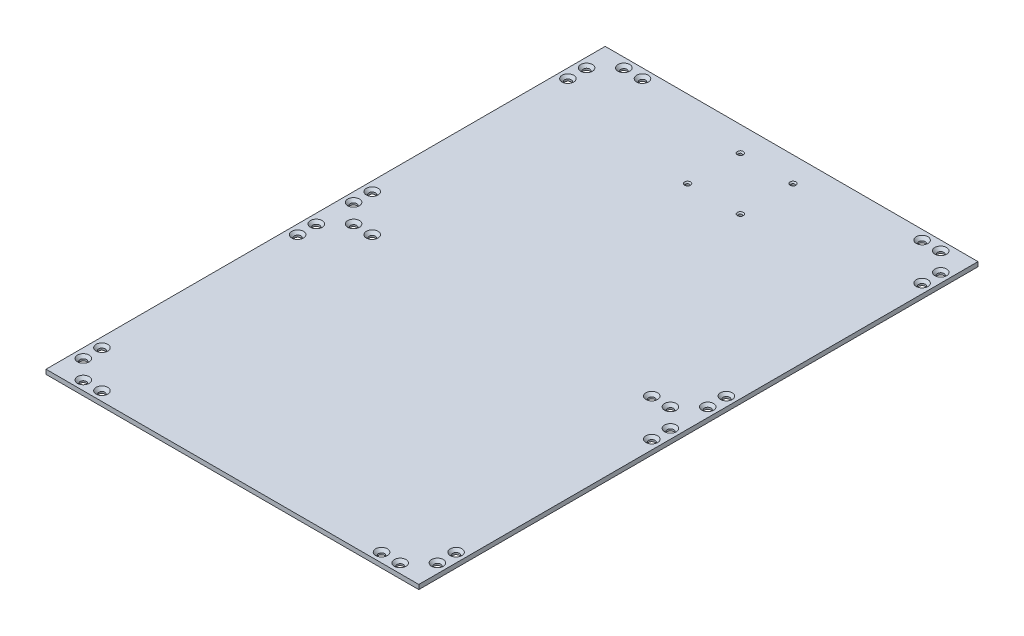
from build123d import *

# Parameters (mm, degrees)
SKETCH1_W                                       = 400
SKETCH1_H                                       = 600
BOSS_EXTRUDE1_DEPTH                             = 4.826
CSK_FOR_M6_FLAT_HEAD_MACHINE_SCREW2_AT_2_COUNT  = 2
CSK_FOR_M6_FLAT_HEAD_MACHINE_SCREW2_AT_2_PITCH  = 20
CSK_FOR_M6_FLAT_HEAD_MACHINE_SCREW2_AT_3_COUNT  = 2
CSK_FOR_M6_FLAT_HEAD_MACHINE_SCREW2_AT_3_PITCH  = 290
CSK_FOR_M6_FLAT_HEAD_MACHINE_SCREW2_AT_4_COUNT  = 2
CSK_FOR_M6_FLAT_HEAD_MACHINE_SCREW2_AT_4_PITCH  = 290.688837075
CSK_FOR_M6_FLAT_HEAD_MACHINE_SCREW2_AT_5_COUNT  = 2
CSK_FOR_M6_FLAT_HEAD_MACHINE_SCREW2_AT_5_PITCH  = 580
CSK_FOR_M6_FLAT_HEAD_MACHINE_SCREW2_AT_6_COUNT  = 2
CSK_FOR_M6_FLAT_HEAD_MACHINE_SCREW2_AT_6_PITCH  = 580.344725142
CSK_FOR_M6_FLAT_HEAD_MACHINE_SCREW2_AT_7_COUNT  = 2
CSK_FOR_M6_FLAT_HEAD_MACHINE_SCREW2_AT_7_PITCH  = 672.309452559
CSK_FOR_M6_FLAT_HEAD_MACHINE_SCREW2_AT_8_COUNT  = 2
CSK_FOR_M6_FLAT_HEAD_MACHINE_SCREW2_AT_8_PITCH  = 662.419806467
CSK_FOR_M6_FLAT_HEAD_MACHINE_SCREW2_AT_9_COUNT  = 2
CSK_FOR_M6_FLAT_HEAD_MACHINE_SCREW2_AT_9_PITCH  = 446.87805943
CSK_FOR_M6_FLAT_HEAD_MACHINE_SCREW2_AT_1_COUNT  = 2
CSK_FOR_M6_FLAT_HEAD_MACHINE_SCREW2_AT_1_PITCH  = 431.856457634
CSK_FOR_M6_FLAT_HEAD_MACHINE_SCREW2_2_COUNT     = 2
CSK_FOR_M6_FLAT_HEAD_MACHINE_SCREW2_2_PITCH     = 340
CSK_FOR_M6_FLAT_HEAD_MACHINE_SCREW2_3_COUNT     = 2
CSK_FOR_M6_FLAT_HEAD_MACHINE_SCREW2_3_PITCH     = 320
CSK_FOR_M3_FLAT_HEAD_MACHINE_SCREW1_D           = 3.6
CSK_FOR_M3_FLAT_HEAD_MACHINE_SCREW1_CSINK_D     = 6.3
CSK_FOR_M3_FLAT_HEAD_MACHINE_SCREW1_CSINK_ANGLE = 90
CSK_FOR_M6_FLAT_HEAD_MACHINE_SCREW3_AT_2_COUNT  = 2
CSK_FOR_M6_FLAT_HEAD_MACHINE_SCREW3_AT_2_PITCH  = 20
CSK_FOR_M6_FLAT_HEAD_MACHINE_SCREW3_AT_3_COUNT  = 2
CSK_FOR_M6_FLAT_HEAD_MACHINE_SCREW3_AT_3_PITCH  = 40
CSK_FOR_M6_FLAT_HEAD_MACHINE_SCREW3_AT_4_COUNT  = 2
CSK_FOR_M6_FLAT_HEAD_MACHINE_SCREW3_AT_4_PITCH  = 60
CSK_FOR_M6_FLAT_HEAD_MACHINE_SCREW3_AT_5_COUNT  = 2
CSK_FOR_M6_FLAT_HEAD_MACHINE_SCREW3_AT_5_PITCH  = 380
CSK_FOR_M6_FLAT_HEAD_MACHINE_SCREW3_AT_6_COUNT  = 2
CSK_FOR_M6_FLAT_HEAD_MACHINE_SCREW3_AT_6_PITCH  = 380.525951809
CSK_FOR_M6_FLAT_HEAD_MACHINE_SCREW3_AT_7_COUNT  = 2
CSK_FOR_M6_FLAT_HEAD_MACHINE_SCREW3_AT_7_PITCH  = 382.099463491
CSK_FOR_M6_FLAT_HEAD_MACHINE_SCREW3_AT_8_COUNT  = 2
CSK_FOR_M6_FLAT_HEAD_MACHINE_SCREW3_AT_8_PITCH  = 384.707681233
CSK_FOR_M6_FLAT_HEAD_MACHINE_SCREW3_AT_9_COUNT  = 2
CSK_FOR_M6_FLAT_HEAD_MACHINE_SCREW3_AT_9_PITCH  = 444.18464629
CSK_FOR_M6_FLAT_HEAD_MACHINE_SCREW3_AT_1_COUNT  = 2
CSK_FOR_M6_FLAT_HEAD_MACHINE_SCREW3_AT_1_PITCH  = 454.862616622
CSK_FOR_M6_FLAT_HEAD_MACHINE_SCREW3_2_COUNT     = 2
CSK_FOR_M6_FLAT_HEAD_MACHINE_SCREW3_2_PITCH     = 250
CSK_FOR_M6_FLAT_HEAD_MACHINE_SCREW3_3_COUNT     = 2
CSK_FOR_M6_FLAT_HEAD_MACHINE_SCREW3_3_PITCH     = 230
CSK_FOR_M6_FLAT_HEAD_MACHINE_SCREW3_4_COUNT     = 2
CSK_FOR_M6_FLAT_HEAD_MACHINE_SCREW3_4_PITCH     = 290
CSK_FOR_M6_FLAT_HEAD_MACHINE_SCREW3_5_COUNT     = 2
CSK_FOR_M6_FLAT_HEAD_MACHINE_SCREW3_5_PITCH     = 270
CSK_FOR_M6_FLAT_HEAD_MACHINE_SCREW3_6_COUNT     = 2
CSK_FOR_M6_FLAT_HEAD_MACHINE_SCREW3_6_PITCH     = 478.016736109
CSK_FOR_M6_FLAT_HEAD_MACHINE_SCREW3_7_COUNT     = 2
CSK_FOR_M6_FLAT_HEAD_MACHINE_SCREW3_7_PITCH     = 466.154480832


with BuildPart() as part:
    # Sketch1 → Boss-Extrude1 (new body)
    with BuildSketch(Plane(origin=(0, 0, 0), x_dir=(1, 0, 0), z_dir=(0, 1, 0))):
        with Locations((200, -300)):
            Rectangle(SKETCH1_W, SKETCH1_H)
    extrude(amount=BOSS_EXTRUDE1_DEPTH)

    # Sketch8 → CSK for M6 Flat Head Machine Screw2 (revolve, cut)
    with BuildSketch(Plane(origin=(370, 4.826, 10), x_dir=(0, 0, 1), z_dir=(1, 0, 0))):
        Polygon((0, 0), (0, 4.826), (3.3, 4.826), (3.3, 3), (6.3, 0), align=None)
    csk_for_m6_flat_head_machine_screw2 = revolve(axis=Axis((370, 11.176, 10), (0, -1, 0)), mode=Mode.SUBTRACT)

    # CSK for M6 Flat Head Machine Screw2 at 2: CSK for M6 Flat Head Machine Screw2 ×2
    with Locations(*[(-i * CSK_FOR_M6_FLAT_HEAD_MACHINE_SCREW2_AT_2_PITCH, 0, 0) for i in range(1, CSK_FOR_M6_FLAT_HEAD_MACHINE_SCREW2_AT_2_COUNT)]):
        add(csk_for_m6_flat_head_machine_screw2, mode=Mode.SUBTRACT)

    # CSK for M6 Flat Head Machine Screw2 at 3: CSK for M6 Flat Head Machine Screw2 ×2
    with Locations(*[(0, 0, i * CSK_FOR_M6_FLAT_HEAD_MACHINE_SCREW2_AT_3_PITCH) for i in range(1, CSK_FOR_M6_FLAT_HEAD_MACHINE_SCREW2_AT_3_COUNT)]):
        add(csk_for_m6_flat_head_machine_screw2, mode=Mode.SUBTRACT)

    # CSK for M6 Flat Head Machine Screw2 at 4: CSK for M6 Flat Head Machine Screw2 ×2
    with Locations(*[Vector(-0.06880209161537774, 0, 0.9976303284229832) * (i * CSK_FOR_M6_FLAT_HEAD_MACHINE_SCREW2_AT_4_PITCH) for i in range(1, CSK_FOR_M6_FLAT_HEAD_MACHINE_SCREW2_AT_4_COUNT)]):
        add(csk_for_m6_flat_head_machine_screw2, mode=Mode.SUBTRACT)

    # CSK for M6 Flat Head Machine Screw2 at 5: CSK for M6 Flat Head Machine Screw2 ×2
    with Locations(*[(0, 0, i * CSK_FOR_M6_FLAT_HEAD_MACHINE_SCREW2_AT_5_PITCH) for i in range(1, CSK_FOR_M6_FLAT_HEAD_MACHINE_SCREW2_AT_5_COUNT)]):
        add(csk_for_m6_flat_head_machine_screw2, mode=Mode.SUBTRACT)

    # CSK for M6 Flat Head Machine Screw2 at 6: CSK for M6 Flat Head Machine Screw2 ×2
    with Locations(*[Vector(-0.03446227583977849, 0, 0.9994059993535875) * (i * CSK_FOR_M6_FLAT_HEAD_MACHINE_SCREW2_AT_6_PITCH) for i in range(1, CSK_FOR_M6_FLAT_HEAD_MACHINE_SCREW2_AT_6_COUNT)]):
        add(csk_for_m6_flat_head_machine_screw2, mode=Mode.SUBTRACT)

    # CSK for M6 Flat Head Machine Screw2 at 7: CSK for M6 Flat Head Machine Screw2 ×2
    with Locations(*[Vector(-0.5057194997124201, 0, 0.8626979700976579) * (i * CSK_FOR_M6_FLAT_HEAD_MACHINE_SCREW2_AT_7_PITCH) for i in range(1, CSK_FOR_M6_FLAT_HEAD_MACHINE_SCREW2_AT_7_COUNT)]):
        add(csk_for_m6_flat_head_machine_screw2, mode=Mode.SUBTRACT)

    # CSK for M6 Flat Head Machine Screw2 at 8: CSK for M6 Flat Head Machine Screw2 ×2
    with Locations(*[Vector(-0.48307734291133475, 0, 0.8755776840267943) * (i * CSK_FOR_M6_FLAT_HEAD_MACHINE_SCREW2_AT_8_PITCH) for i in range(1, CSK_FOR_M6_FLAT_HEAD_MACHINE_SCREW2_AT_8_COUNT)]):
        add(csk_for_m6_flat_head_machine_screw2, mode=Mode.SUBTRACT)

    # CSK for M6 Flat Head Machine Screw2 at 9: CSK for M6 Flat Head Machine Screw2 ×2
    with Locations(*[Vector(-0.7608339519590858, 0, 0.6489466060827498) * (i * CSK_FOR_M6_FLAT_HEAD_MACHINE_SCREW2_AT_9_PITCH) for i in range(1, CSK_FOR_M6_FLAT_HEAD_MACHINE_SCREW2_AT_9_COUNT)]):
        add(csk_for_m6_flat_head_machine_screw2, mode=Mode.SUBTRACT)

    # CSK for M6 Flat Head Machine Screw2 at 1: CSK for M6 Flat Head Machine Screw2 ×2
    with Locations(*[Vector(-0.7409869514359826, 0, 0.6715194247388595) * (i * CSK_FOR_M6_FLAT_HEAD_MACHINE_SCREW2_AT_1_PITCH) for i in range(1, CSK_FOR_M6_FLAT_HEAD_MACHINE_SCREW2_AT_1_COUNT)]):
        add(csk_for_m6_flat_head_machine_screw2, mode=Mode.SUBTRACT)

    # CSK for M6 Flat Head Machine Screw2  2: CSK for M6 Flat Head Machine Screw2 ×2
    with Locations(*[(-i * CSK_FOR_M6_FLAT_HEAD_MACHINE_SCREW2_2_PITCH, 0, 0) for i in range(1, CSK_FOR_M6_FLAT_HEAD_MACHINE_SCREW2_2_COUNT)]):
        add(csk_for_m6_flat_head_machine_screw2, mode=Mode.SUBTRACT)

    # CSK for M6 Flat Head Machine Screw2  3: CSK for M6 Flat Head Machine Screw2 ×2
    with Locations(*[(-i * CSK_FOR_M6_FLAT_HEAD_MACHINE_SCREW2_3_PITCH, 0, 0) for i in range(1, CSK_FOR_M6_FLAT_HEAD_MACHINE_SCREW2_3_COUNT)]):
        add(csk_for_m6_flat_head_machine_screw2, mode=Mode.SUBTRACT)

    # CSK for M3 Flat Head Machine Screw1 (through all)
    with Locations(Plane(origin=(0, 4.826, 0), x_dir=(1, 0, 0), z_dir=(0, 1, 0))):
        with Locations((171.715728753, -26.715728753), (228.284271247, -26.715728753), (228.284271247, -83.284271247), (171.715728753, -83.284271247)):
            CounterSinkHole(CSK_FOR_M3_FLAT_HEAD_MACHINE_SCREW1_D / 2, CSK_FOR_M3_FLAT_HEAD_MACHINE_SCREW1_CSINK_D / 2, counter_sink_angle=CSK_FOR_M3_FLAT_HEAD_MACHINE_SCREW1_CSINK_ANGLE)

    # Sketch12 → CSK for M6 Flat Head Machine Screw3 (revolve, cut)
    with BuildSketch(Plane(origin=(10, 4.826, 320), x_dir=(0, 0, 1), z_dir=(1, 0, 0))):
        Polygon((0, 0), (0, 4.826), (3.5, 4.826), (3.5, 2.8), (6.3, 0), align=None)
    csk_for_m6_flat_head_machine_screw3 = revolve(axis=Axis((10, 11.176, 320), (0, -1, 0)), mode=Mode.SUBTRACT)

    # CSK for M6 Flat Head Machine Screw3 at 2: CSK for M6 Flat Head Machine Screw3 ×2
    with Locations(*[(0, 0, i * CSK_FOR_M6_FLAT_HEAD_MACHINE_SCREW3_AT_2_PITCH) for i in range(1, CSK_FOR_M6_FLAT_HEAD_MACHINE_SCREW3_AT_2_COUNT)]):
        add(csk_for_m6_flat_head_machine_screw3, mode=Mode.SUBTRACT)

    # CSK for M6 Flat Head Machine Screw3 at 3: CSK for M6 Flat Head Machine Screw3 ×2
    with Locations(*[(0, 0, -i * CSK_FOR_M6_FLAT_HEAD_MACHINE_SCREW3_AT_3_PITCH) for i in range(1, CSK_FOR_M6_FLAT_HEAD_MACHINE_SCREW3_AT_3_COUNT)]):
        add(csk_for_m6_flat_head_machine_screw3, mode=Mode.SUBTRACT)

    # CSK for M6 Flat Head Machine Screw3 at 4: CSK for M6 Flat Head Machine Screw3 ×2
    with Locations(*[(0, 0, -i * CSK_FOR_M6_FLAT_HEAD_MACHINE_SCREW3_AT_4_PITCH) for i in range(1, CSK_FOR_M6_FLAT_HEAD_MACHINE_SCREW3_AT_4_COUNT)]):
        add(csk_for_m6_flat_head_machine_screw3, mode=Mode.SUBTRACT)

    # CSK for M6 Flat Head Machine Screw3 at 5: CSK for M6 Flat Head Machine Screw3 ×2
    with Locations(*[(i * CSK_FOR_M6_FLAT_HEAD_MACHINE_SCREW3_AT_5_PITCH, 0, 0) for i in range(1, CSK_FOR_M6_FLAT_HEAD_MACHINE_SCREW3_AT_5_COUNT)]):
        add(csk_for_m6_flat_head_machine_screw3, mode=Mode.SUBTRACT)

    # CSK for M6 Flat Head Machine Screw3 at 6: CSK for M6 Flat Head Machine Screw3 ×2
    with Locations(*[Vector(0.9986178293325098, 0, 0.052558833122763646) * (i * CSK_FOR_M6_FLAT_HEAD_MACHINE_SCREW3_AT_6_PITCH) for i in range(1, CSK_FOR_M6_FLAT_HEAD_MACHINE_SCREW3_AT_6_COUNT)]):
        add(csk_for_m6_flat_head_machine_screw3, mode=Mode.SUBTRACT)

    # CSK for M6 Flat Head Machine Screw3 at 7: CSK for M6 Flat Head Machine Screw3 ×2
    with Locations(*[Vector(0.994505452921406, 0, -0.10468478451804311) * (i * CSK_FOR_M6_FLAT_HEAD_MACHINE_SCREW3_AT_7_PITCH) for i in range(1, CSK_FOR_M6_FLAT_HEAD_MACHINE_SCREW3_AT_7_COUNT)]):
        add(csk_for_m6_flat_head_machine_screw3, mode=Mode.SUBTRACT)

    # CSK for M6 Flat Head Machine Screw3 at 8: CSK for M6 Flat Head Machine Screw3 ×2
    with Locations(*[Vector(0.987762965329069, 0, -0.15596257347301137) * (i * CSK_FOR_M6_FLAT_HEAD_MACHINE_SCREW3_AT_8_PITCH) for i in range(1, CSK_FOR_M6_FLAT_HEAD_MACHINE_SCREW3_AT_8_COUNT)]):
        add(csk_for_m6_flat_head_machine_screw3, mode=Mode.SUBTRACT)

    # CSK for M6 Flat Head Machine Screw3 at 9: CSK for M6 Flat Head Machine Screw3 ×2
    with Locations(*[Vector(0.8555000790182328, 0, 0.517802679405773) * (i * CSK_FOR_M6_FLAT_HEAD_MACHINE_SCREW3_AT_9_PITCH) for i in range(1, CSK_FOR_M6_FLAT_HEAD_MACHINE_SCREW3_AT_9_COUNT)]):
        add(csk_for_m6_flat_head_machine_screw3, mode=Mode.SUBTRACT)

    # CSK for M6 Flat Head Machine Screw3 at 1: CSK for M6 Flat Head Machine Screw3 ×2
    with Locations(*[Vector(0.8354170822439396, 0, 0.5496165014762773) * (i * CSK_FOR_M6_FLAT_HEAD_MACHINE_SCREW3_AT_1_PITCH) for i in range(1, CSK_FOR_M6_FLAT_HEAD_MACHINE_SCREW3_AT_1_COUNT)]):
        add(csk_for_m6_flat_head_machine_screw3, mode=Mode.SUBTRACT)

    # CSK for M6 Flat Head Machine Screw3  2: CSK for M6 Flat Head Machine Screw3 ×2
    with Locations(*[(0, 0, i * CSK_FOR_M6_FLAT_HEAD_MACHINE_SCREW3_2_PITCH) for i in range(1, CSK_FOR_M6_FLAT_HEAD_MACHINE_SCREW3_2_COUNT)]):
        add(csk_for_m6_flat_head_machine_screw3, mode=Mode.SUBTRACT)

    # CSK for M6 Flat Head Machine Screw3  3: CSK for M6 Flat Head Machine Screw3 ×2
    with Locations(*[(0, 0, i * CSK_FOR_M6_FLAT_HEAD_MACHINE_SCREW3_3_PITCH) for i in range(1, CSK_FOR_M6_FLAT_HEAD_MACHINE_SCREW3_3_COUNT)]):
        add(csk_for_m6_flat_head_machine_screw3, mode=Mode.SUBTRACT)

    # CSK for M6 Flat Head Machine Screw3  4: CSK for M6 Flat Head Machine Screw3 ×2
    with Locations(*[(0, 0, -i * CSK_FOR_M6_FLAT_HEAD_MACHINE_SCREW3_4_PITCH) for i in range(1, CSK_FOR_M6_FLAT_HEAD_MACHINE_SCREW3_4_COUNT)]):
        add(csk_for_m6_flat_head_machine_screw3, mode=Mode.SUBTRACT)

    # CSK for M6 Flat Head Machine Screw3  5: CSK for M6 Flat Head Machine Screw3 ×2
    with Locations(*[(0, 0, -i * CSK_FOR_M6_FLAT_HEAD_MACHINE_SCREW3_5_PITCH) for i in range(1, CSK_FOR_M6_FLAT_HEAD_MACHINE_SCREW3_5_COUNT)]):
        add(csk_for_m6_flat_head_machine_screw3, mode=Mode.SUBTRACT)

    # CSK for M6 Flat Head Machine Screw3  6: CSK for M6 Flat Head Machine Screw3 ×2
    with Locations(*[Vector(0.7949512460450773, 0, -0.6066733193501912) * (i * CSK_FOR_M6_FLAT_HEAD_MACHINE_SCREW3_6_PITCH) for i in range(1, CSK_FOR_M6_FLAT_HEAD_MACHINE_SCREW3_6_COUNT)]):
        add(csk_for_m6_flat_head_machine_screw3, mode=Mode.SUBTRACT)

    # CSK for M6 Flat Head Machine Screw3  7: CSK for M6 Flat Head Machine Screw3 ×2
    with Locations(*[Vector(0.8151804082662736, 0, -0.579207132189195) * (i * CSK_FOR_M6_FLAT_HEAD_MACHINE_SCREW3_7_PITCH) for i in range(1, CSK_FOR_M6_FLAT_HEAD_MACHINE_SCREW3_7_COUNT)]):
        add(csk_for_m6_flat_head_machine_screw3, mode=Mode.SUBTRACT)


solid = part.part
